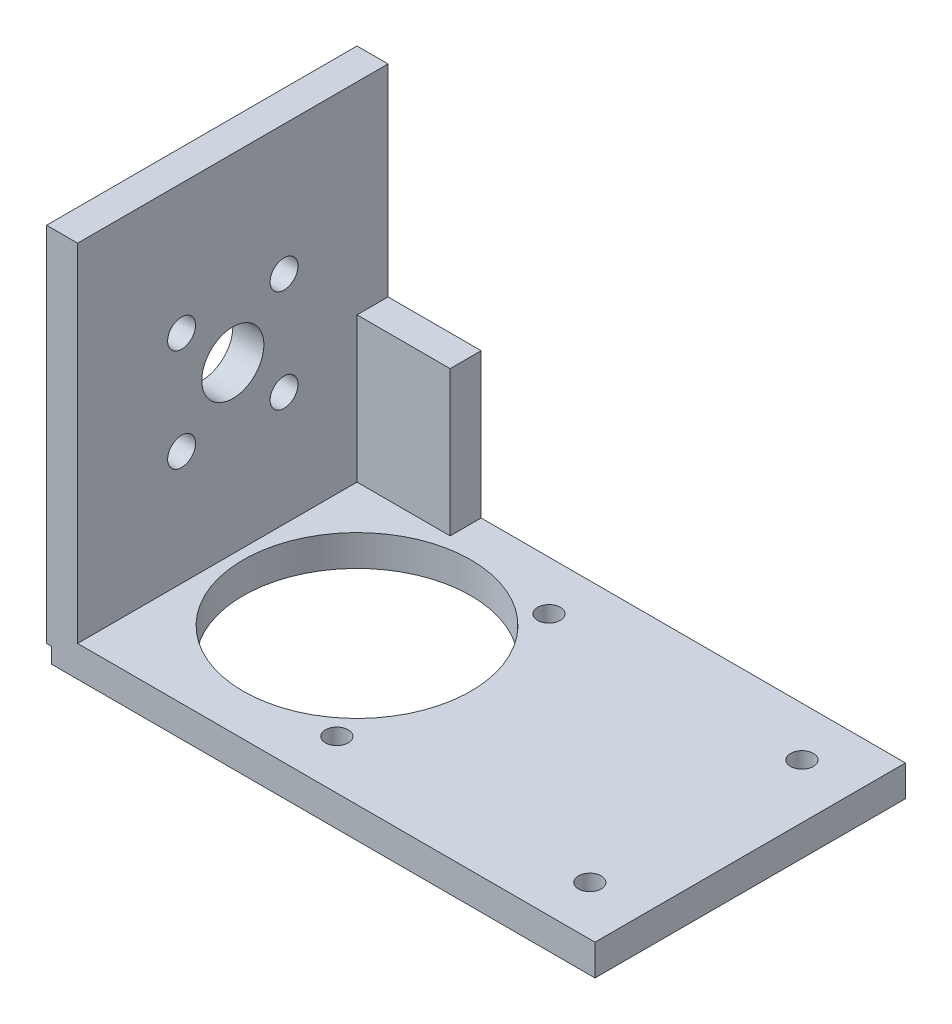
from build123d import *

# Parameters (mm, degrees)
S_BOX1_W      = 3
S_BOX1_H      = 35
BOSS_1_DEPTH  = 30
S_BOX2_W      = 52.5
S_BOX2_H      = 3
BOSS_2_DEPTH  = 30
S_BOX3_W      = 11.5
S_BOX3_H      = 16.5
BOSS_3_DEPTH  = 3
S_HOLE4_R     = 3
HOLE_4_DEPTH  = 3.2
S_HOLE5_R     = 1.35
HOLE_5_DEPTH  = 3.2
S_HOLE6_R     = 1.35
HOLE_6_DEPTH  = 3.2
S_HOLE7_R     = 1.35
HOLE_7_DEPTH  = 3.2
S_HOLE8_R     = 1.35
HOLE_8_DEPTH  = 3.2
S_HOLE9_R     = 11
HOLE_9_DEPTH  = 3.2
S_HOLE10_R    = 1.1
HOLE_10_DEPTH = 3.2
S_HOLE11_R    = 1.1
HOLE_11_DEPTH = 3.2
S_HOLE12_R    = 1.1
HOLE_12_DEPTH = 3.2
S_HOLE13_R    = 1.1
HOLE_13_DEPTH = 3.2


with BuildPart() as part:
    # S_box1 → Boss_1 (new body)
    with BuildSketch(Plane.XY.offset(-15)):
        with Locations((-13.5, 0)):
            Rectangle(S_BOX1_W, S_BOX1_H)
    extrude(amount=BOSS_1_DEPTH)

    # S_box2 → Boss_2 (add)
    with BuildSketch(Plane.XY.offset(-15)):
        with Locations((11.75, -17.5)):
            Rectangle(S_BOX2_W, S_BOX2_H)
    extrude(amount=BOSS_2_DEPTH)

    # S_box3 → Boss_3 (add)
    with BuildSketch(Plane.XY.offset(-15)):
        with Locations((-8.75, -10.25)):
            Rectangle(S_BOX3_W, S_BOX3_H)
    extrude(amount=BOSS_3_DEPTH)

    # S_hole4 → Hole_4 (cut)
    with BuildSketch(Plane(origin=(-15.1, 0, 0), x_dir=(0, 0, -1), z_dir=(1, 0, 0))):
        Circle(S_HOLE4_R)
    extrude(amount=HOLE_4_DEPTH, mode=Mode.SUBTRACT)

    # S_hole5 → Hole_5 (cut)
    with BuildSketch(Plane(origin=(-15.1, 0, 0), x_dir=(0, 0, -1), z_dir=(1, 0, 0))):
        with Locations((-4.949747468, 4.949747468)):
            Circle(S_HOLE5_R)
    extrude(amount=HOLE_5_DEPTH, mode=Mode.SUBTRACT)

    # S_hole6 → Hole_6 (cut)
    with BuildSketch(Plane(origin=(-15.1, 0, 0), x_dir=(0, 0, -1), z_dir=(1, 0, 0))):
        with Locations((-4.949747468, -4.949747468)):
            Circle(S_HOLE6_R)
    extrude(amount=HOLE_6_DEPTH, mode=Mode.SUBTRACT)

    # S_hole7 → Hole_7 (cut)
    with BuildSketch(Plane(origin=(-15.1, 0, 0), x_dir=(0, 0, -1), z_dir=(1, 0, 0))):
        with Locations((4.949747468, -4.949747468)):
            Circle(S_HOLE7_R)
    extrude(amount=HOLE_7_DEPTH, mode=Mode.SUBTRACT)

    # S_hole8 → Hole_8 (cut)
    with BuildSketch(Plane(origin=(-15.1, 0, 0), x_dir=(0, 0, -1), z_dir=(1, 0, 0))):
        with Locations((4.949747468, 4.949747468)):
            Circle(S_HOLE8_R)
    extrude(amount=HOLE_8_DEPTH, mode=Mode.SUBTRACT)

    # S_hole9 → Hole_9 (cut)
    with BuildSketch(Plane(origin=(0, -19.1, 0), x_dir=(1, 0, 0), z_dir=(0, 1, 0))):
        Circle(S_HOLE9_R)
    extrude(amount=HOLE_9_DEPTH, mode=Mode.SUBTRACT)

    # S_hole10 → Hole_10 (cut)
    with BuildSketch(Plane(origin=(0, -19.1, 0), x_dir=(1, 0, 0), z_dir=(0, 1, 0))):
        with Locations((8.3, 10.25)):
            Circle(S_HOLE10_R)
    extrude(amount=HOLE_10_DEPTH, mode=Mode.SUBTRACT)

    # S_hole11 → Hole_11 (cut)
    with BuildSketch(Plane(origin=(0, -19.1, 0), x_dir=(1, 0, 0), z_dir=(0, 1, 0))):
        with Locations((8.3, -10.25)):
            Circle(S_HOLE11_R)
    extrude(amount=HOLE_11_DEPTH, mode=Mode.SUBTRACT)

    # S_hole12 → Hole_12 (cut)
    with BuildSketch(Plane(origin=(0, -19.1, 0), x_dir=(1, 0, 0), z_dir=(0, 1, 0))):
        with Locations((32.75, 10.25)):
            Circle(S_HOLE12_R)
    extrude(amount=HOLE_12_DEPTH, mode=Mode.SUBTRACT)

    # S_hole13 → Hole_13 (cut)
    with BuildSketch(Plane(origin=(0, -19.1, 0), x_dir=(1, 0, 0), z_dir=(0, 1, 0))):
        with Locations((32.75, -10.25)):
            Circle(S_HOLE13_R)
    extrude(amount=HOLE_13_DEPTH, mode=Mode.SUBTRACT)


solid = part.part
